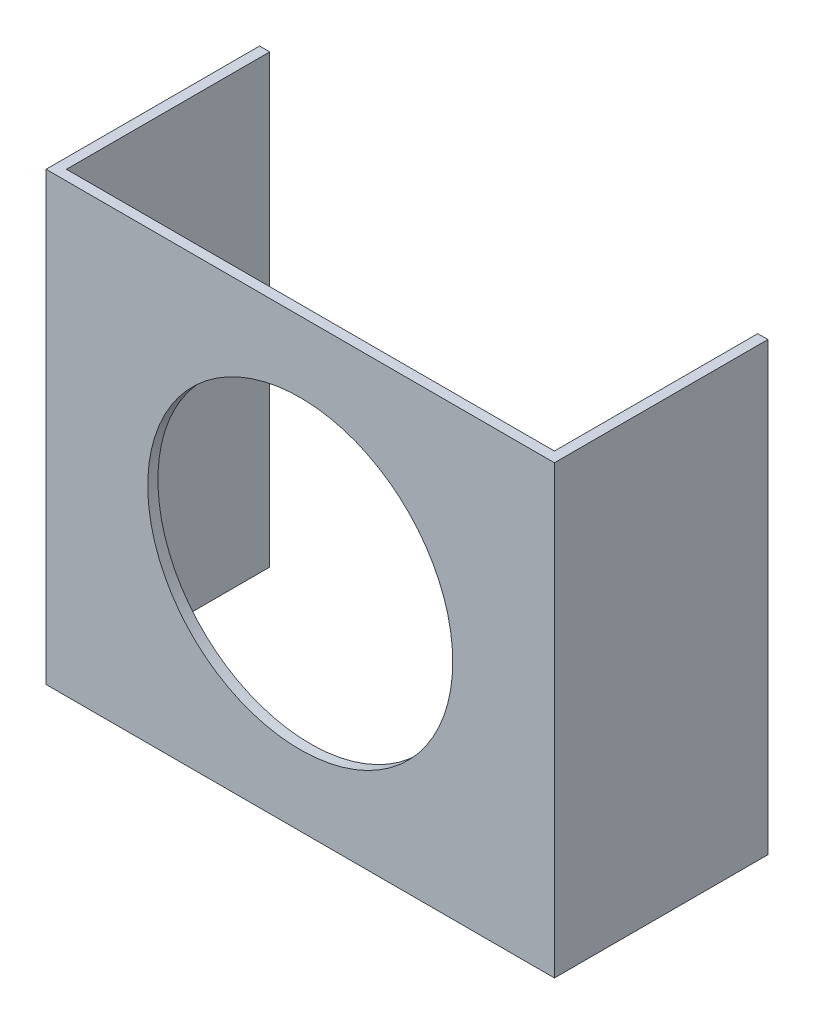
from build123d import *

# Parameters (mm, degrees)
SKETCH1_W           = 50.000000596
SKETCH1_H           = 43.88833532
BOSS_EXTRUDE1_DEPTH = 1
SKETCH2_W           = 1
SKETCH2_H           = 43.88833532
BOSS_EXTRUDE3_DEPTH = 20
SKETCH3_R           = 15
CUT_EXTRUDE1_DEPTH  = 40.338867665


with BuildPart() as part:
    # Sketch1 → Boss-Extrude1 (new body)
    with BuildSketch(Plane.XY):
        Rectangle(SKETCH1_W, SKETCH1_H)
    extrude(amount=BOSS_EXTRUDE1_DEPTH)

    # Sketch2 → Boss-Extrude3 (add)
    with BuildSketch(Plane(origin=(0, 0, 0), x_dir=(-1, 0, 0), z_dir=(0, 0, -1))):
        with Locations((-24.500000298, 0)):
            Rectangle(SKETCH2_W, SKETCH2_H)
        with Locations((24.500000298, 0)):
            Rectangle(SKETCH2_W, SKETCH2_H)
    extrude(amount=BOSS_EXTRUDE3_DEPTH)

    # Sketch3 → Cut-Extrude1 (cut, through all)
    with BuildSketch(Plane.XY.offset(1)):
        Circle(SKETCH3_R)
    extrude(amount=-CUT_EXTRUDE1_DEPTH, mode=Mode.SUBTRACT)


solid = part.part
